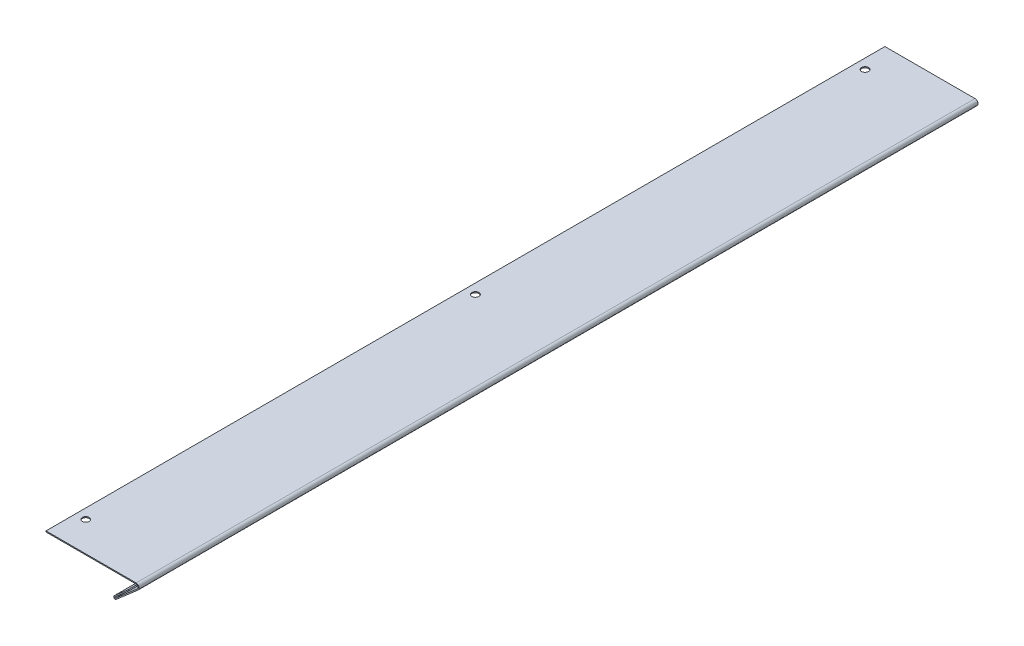
from build123d import *

# Parameters (mm, degrees)
SKETCH1_W                    = 48
SKETCH1_H                    = 0.5
BASE_FLANGE1_DEPTH           = 211
SKETCH6_R                    = 1.75
CUT_EXTRUDE1_DEPTH           = 10
EDGE_FLANGE1_STRIP_CUT_DEPTH = 422
EDGE_FLANGE1_DEPTH           = 422
HEM1_START                   = -211
HEM1_DEPTH                   = 422
HEM1_2_DEPTH                 = 422


# Read off the part's stored shape, not the designer's step: Hem1
# Sheet-metal steps are written as plain solids
with BuildPart() as part:
    # Sketch1 → Base-Flange1 (new, symmetric)
    with BuildSketch(Plane.XY):
        with Locations((24, -0.25)):
            Rectangle(SKETCH1_W, SKETCH1_H)
    extrude(amount=BASE_FLANGE1_DEPTH, both=True)

    # Sketch6 → Cut-Extrude1 (cut)
    with BuildSketch(Plane(origin=(0, 0, 0), x_dir=(1, 0, 0), z_dir=(0, 1, 0))):
        with Locations(Location((5, 196, 0), (0, 0, 270))):
            Circle(SKETCH6_R)
        with Locations(Location((5, 0, 0), (0, 0, 270))):
            Circle(SKETCH6_R)
        with Locations(Location((5, -196, 0), (0, 0, 270))):
            Circle(SKETCH6_R)
    extrude(amount=-CUT_EXTRUDE1_DEPTH, mode=Mode.SUBTRACT)

    # Edge-Flange1 strip (across the edge) → Edge-Flange1 strip cut (cut)
    with BuildSketch(Plane(origin=(48, -0.5, -211), x_dir=(-0.6560590289905086, 0.754709580222771, 0), z_dir=(0, 0, 1))):
        Polygon((-4.886773951, -6.383716909), (2.13206437, 1.69053295), (1.75470958, 2.018562465), (-5.264128741, -6.055687395), align=None)
    extrude(amount=EDGE_FLANGE1_STRIP_CUT_DEPTH, mode=Mode.SUBTRACT)

    # Edge-Flange1 section (across the edge) → Edge-Flange1 (add)
    with BuildSketch(Plane(origin=(48, -0.5, -211), x_dir=(-0.6560590289905086, 0.754709580222771, 0), z_dir=(0, 0, 1))):
        with BuildLine():
            Line((-0.5, 2.674621494), (-0.5, 18))
            Line((-0.5, 18), (0, 18))
            Line((0, 18), (0, 2.674621494))
            ThreePointArc((0, 2.674621494), (0.649792619, 1.737949305), (1.75470958, 2.018562465))
            Line((1.75470958, 2.018562465), (2.13206437, 1.69053295))
            ThreePointArc((2.13206437, 1.69053295), (0.474688928, 1.26961321), (-0.5, 2.674621494))
        make_face()
    extrude(amount=EDGE_FLANGE1_DEPTH)

    # Hem1 outline → Hem1 (cut)
    with BuildSketch(Plane.XY.offset(HEM1_START)):
        with BuildLine():
            ThreePointArc((35.309289256, -12.19437304), (34.892198615, -12.374586092), (34.447599479, -12.280922038))
            Line((34.447599479, -12.280922038), (34.415227556, -12.309062522))
            Line((34.415227556, -12.309062522), (34.74325707, -12.686417312))
            Line((34.74325707, -12.686417312), (35.309289256, -12.19437304))
        make_face()
    extrude(amount=HEM1_DEPTH, mode=Mode.SUBTRACT)

    # Hem1 2 outline → Hem1 2 (add)
    with BuildSketch(Plane.XY.offset(HEM1_START)):
        with BuildLine():
            Line((41.634293844, -5.371117442), (41.306264329, -4.993762652))
            Line((41.306264329, -4.993762652), (34.325200712, -11.06230867))
            ThreePointArc((34.325200712, -11.06230867), (34.070999747, -11.703294486), (34.447599479, -12.280922038))
            Line((34.447599479, -12.280922038), (34.981259741, -11.81701825))
            ThreePointArc((34.981259741, -11.81701825), (34.628567589, -11.792355612), (34.653230227, -11.43966346))
            Line((34.653230227, -11.43966346), (41.634293844, -5.371117442))
        make_face()
    extrude(amount=HEM1_2_DEPTH)


solid = part.part
